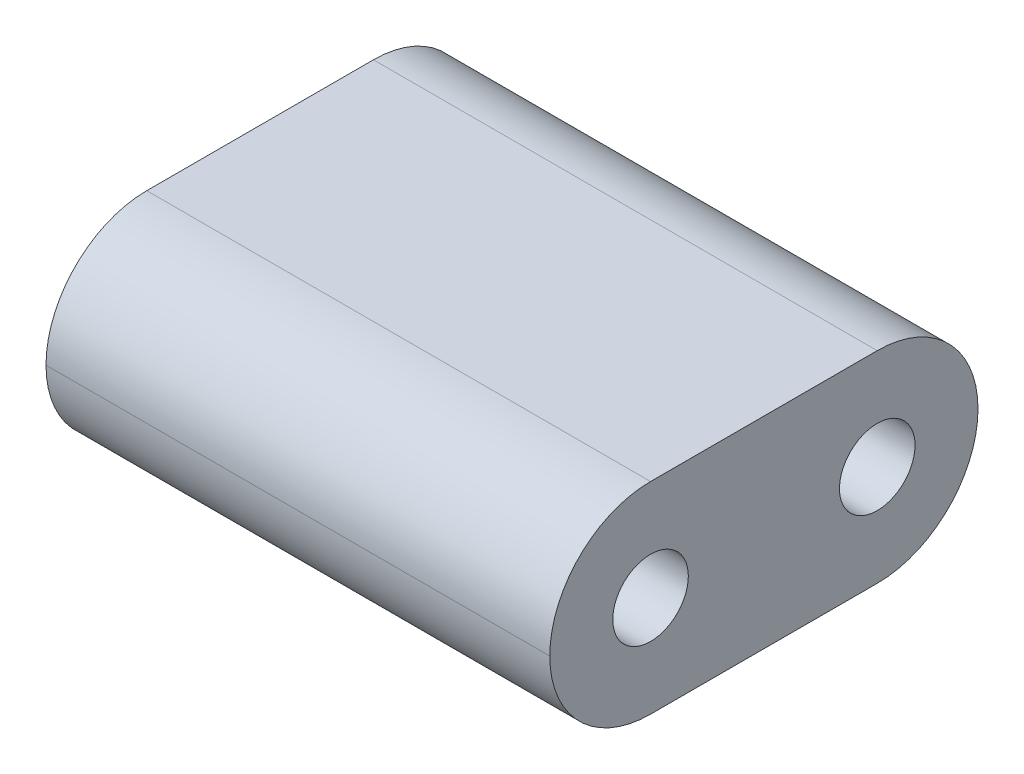
from build123d import *

# Parameters (mm, degrees)
SKETCH1_W           = 12.7
SKETCH1_H           = 10.795
BOSS_EXTRUDE1_DEPTH = 5.08
CUT_EXTRUDE1_REACH  = 19.425
SKETCH2_R           = 0.9525
FILLET1_R           = 2.54


with BuildPart() as part:
    # Sketch1 → Boss-Extrude1 (new body)
    with BuildSketch(Plane(origin=(0, 0, 0), x_dir=(1, 0, 0), z_dir=(0, 1, 0))):
        with Locations((6.35, 5.3975)):
            Rectangle(SKETCH1_W, SKETCH1_H)
    extrude(amount=BOSS_EXTRUDE1_DEPTH)

    # Sketch2 → Cut-Extrude1 (cut, up to next)
    with BuildSketch(Plane(origin=(12.7, 0, 0), x_dir=(0, 0, -1), z_dir=(1, 0, 0)), mode=Mode.PRIVATE) as cut_extrude1_sk1:
        with Locations((2.54, 2.54)):
            Circle(SKETCH2_R)
    cut_extrude1_tool1 = extrude(cut_extrude1_sk1.sketch, amount=-CUT_EXTRUDE1_REACH, mode=Mode.PRIVATE) & part.part
    # Sketch2 → Cut-Extrude1 (cut, up to next)
    with BuildSketch(Plane(origin=(12.7, 0, 0), x_dir=(0, 0, -1), z_dir=(1, 0, 0)), mode=Mode.PRIVATE) as cut_extrude1_sk2:
        with Locations((8.255, 2.54)):
            Circle(SKETCH2_R)
    cut_extrude1_tool2 = extrude(cut_extrude1_sk2.sketch, amount=-CUT_EXTRUDE1_REACH, mode=Mode.PRIVATE) & part.part
    add(cut_extrude1_tool1.solids().sort_by_distance((12.7, 2.54, -2.54))[0], mode=Mode.SUBTRACT)
    add(cut_extrude1_tool2.solids().sort_by_distance((12.7, 2.54, -8.255))[0], mode=Mode.SUBTRACT)

    # Fillet1
    fillet1_edges = [part.edges().sort_by_distance(p)[0] for p in [
        (6.35, 0, -10.795),
        (6.35, 5.08, -10.795),
        (6.35, 0, 0),
        (6.35, 5.08, 0),
    ]]
    fillet(fillet1_edges, radius=FILLET1_R - 0.0001)  # a hair under: the kernel refuses the full size


solid = part.part
